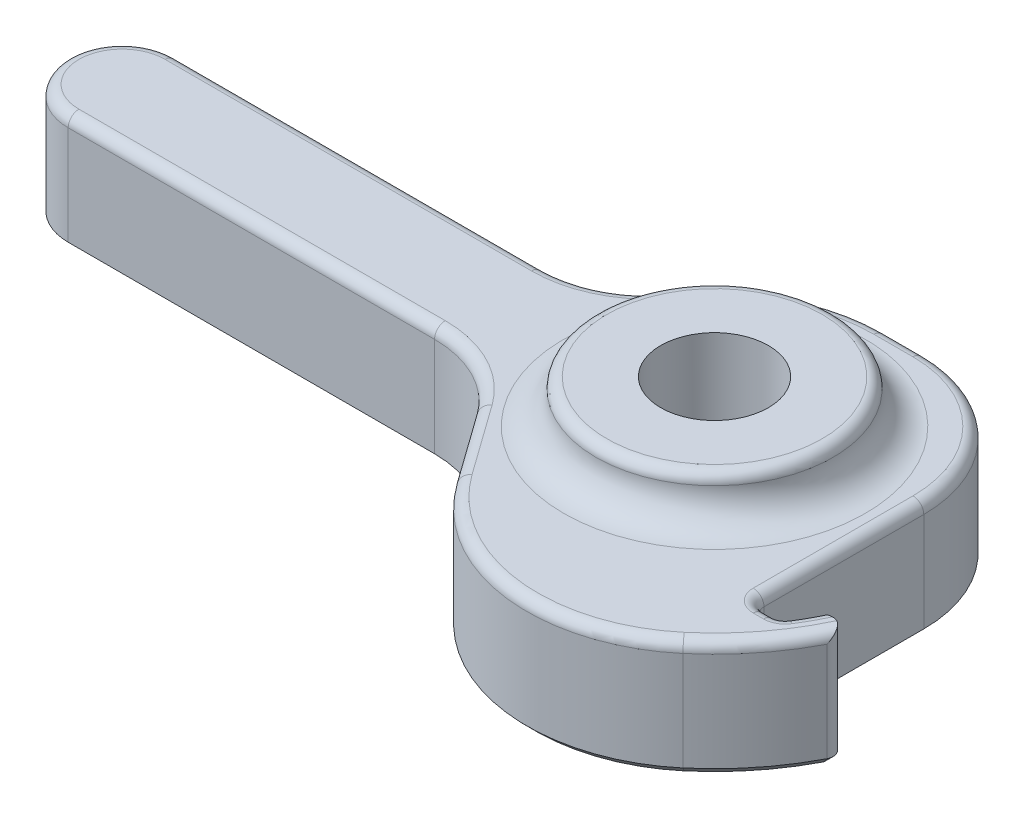
from build123d import *

# Parameters (mm, degrees)
BOSS_EXTRUDE1_START = -2
SKETCH1_R           = 2.5
BOSS_EXTRUDE1_DEPTH = 5.5
BOSS_EXTRUDE2_REACH = 96.191
SKETCH2_R           = 5.5
SKETCH2_R_2         = 2.5
FILLET1_R           = 1.5
FILLET2_R           = 0.5
CHAMFER1_SIZE       = 0.4


with BuildPart() as part:
    # Sketch1 → Boss-Extrude1 (new body)
    with BuildSketch(Plane(origin=(0, -76.733621845, 0), x_dir=(1, 0, 0), z_dir=(0, 1, 0)).offset(BOSS_EXTRUDE1_START)):
        with BuildLine():
            Line((53.041217068, 9.5), (70.045503657, 9.5))
            ThreePointArc((70.045503657, 9.5), (72.332982212, 8.946059138), (74.11360963, 7.406976744))
            Line((74.11360963, 7.406976744), (76.446988808, 4.141579527))
            ThreePointArc((76.446988808, 4.141579527), (82.114772389, 0.763045112), (88.441217068, 2.637708614))
            ThreePointArc((88.441217068, 2.637708614), (90.354455743, 4.667684765), (91.758842367, 7.07786808))
            Line((91.758842367, 7.07786808), (90.378524492, 7.07786808))
            ThreePointArc((90.378524492, 7.07786808), (90.053291089, 6.475468544), (89.691215146, 5.89446684))
            Line((89.691215146, 5.89446684), (88.441217068, 5.89446684))
            Line((88.441217068, 5.89446684), (88.441217068, 12))
            Line((88.441217068, 12), (88.441217068, 13.810660172))
            ThreePointArc((88.441217068, 13.810660172), (86.657690725, 18.116473657), (82.35187724, 19.9))
            Line((82.35187724, 19.9), (80.541217068, 19.9))
            ThreePointArc((80.541217068, 19.9), (76.927000951, 19.024773438), (74.11360963, 16.593023256))
            ThreePointArc((74.11360963, 16.593023256), (72.332982212, 15.053940862), (70.045503657, 14.5))
            Line((70.045503657, 14.5), (53.041217068, 14.5))
            ThreePointArc((53.041217068, 14.5), (50.541217068, 12), (53.041217068, 9.5))
        make_face()
        with Locations(Location((80.541217068, 12, 0), (0, 0, 270))):
            Circle(SKETCH1_R, mode=Mode.SUBTRACT)
    extrude(amount=-BOSS_EXTRUDE1_DEPTH)

    # Sketch2 → Boss-Extrude2 (add, up to next)
    with BuildSketch(Plane(origin=(0, -76.733621845, 0), x_dir=(-1, 0, 0), z_dir=(0, -1, 0)), mode=Mode.PRIVATE) as boss_extrude2_sk1:
        with Locations(Location((-80.541217068, 12, 0), (0, 0, 270))):
            Circle(SKETCH2_R)
        with Locations(Location((-80.541217068, 12, 0), (0, 0, 270))):
            Circle(SKETCH2_R_2, mode=Mode.SUBTRACT)
    boss_extrude2_tool1 = extrude(boss_extrude2_sk1.sketch, amount=BOSS_EXTRUDE2_REACH, mode=Mode.PRIVATE) - part.part
    add(boss_extrude2_tool1.solids().sort_by_distance((80.541217, -76.733622, -17.344437))[0])

    # Fillet1
    fillet1_edges = [part.edges().sort_by_distance(p)[0] for p in [
        (80.541217068, -78.733621845, -17.5),
    ]]
    fillet(fillet1_edges, radius=FILLET1_R)

    # Fillet2
    fillet2_edges = [part.edges().sort_by_distance(p)[0] for p in [
        (89.066216107, -78.733621845, -5.89446684),
        (90.053291089, -78.733621845, -6.475468544),
        (90.354455743, -78.733621845, -4.667684765),
        (82.114772389, -78.733621845, -0.763045112),
        (75.280299219, -78.733621845, -5.774278136),
        (72.332982212, -78.733621845, -8.946059138),
        (61.543360362, -78.733621845, -9.5),
        (50.541217068, -78.733621845, -12),
        (61.543360362, -78.733621845, -14.5),
        (72.332982212, -78.733621845, -15.053940862),
        (76.927000951, -78.733621845, -19.024773438),
        (81.446547154, -78.733621845, -19.9),
        (86.657690725, -78.733621845, -18.116473657),
        (88.441217068, -78.733621845, -9.852563506),
        (88.441217068, -81.483621845, -5.89446684),
        (89.691215146, -81.483621845, -5.89446684),
        (90.378524492, -81.483621845, -7.07786808),
        (91.758842367, -81.483621845, -7.07786808),
        (80.541217068, -76.733621845, -17.5),
    ]]
    fillet(fillet2_edges, radius=FILLET2_R - 0.0001)  # a hair under: the kernel refuses the full size

    # Chamfer1
    chamfer1_edges = [part.edges().sort_by_distance(p)[0] for p in [
        (86.657690725, -84.233621845, -18.116473657),
        (81.446547154, -84.233621845, -19.9),
        (76.927000951, -84.233621845, -19.024773438),
        (72.332982212, -84.233621845, -15.053940862),
        (61.543360362, -84.233621845, -14.5),
        (50.541217068, -84.233621845, -12),
        (61.543360362, -84.233621845, -9.5),
        (80.541217068, -84.233621845, -14.5),
        (72.332982212, -84.233621845, -8.946059138),
        (75.280299219, -84.233621845, -5.774278136),
        (82.114772389, -84.233621845, -0.763045112),
        (90.106673865, -84.233621845, -4.347253026),
        (90.0483511, -84.233621845, -6.46697167),
        (90.824107859, -84.233621845, -7.07786808),
        (89.180451269, -84.233621845, -5.89446684),
        (88.441217068, -84.233621845, -10.102513506),
        (90.425701502, -84.233621845, -7.006759492),
        (91.39286189, -84.233621845, -6.837375819),
        (89.661122586, -84.233621845, -5.95658104),
        (88.587634388, -84.233621845, -6.04088416),
    ]]
    chamfer(chamfer1_edges, length=CHAMFER1_SIZE)


solid = part.part
